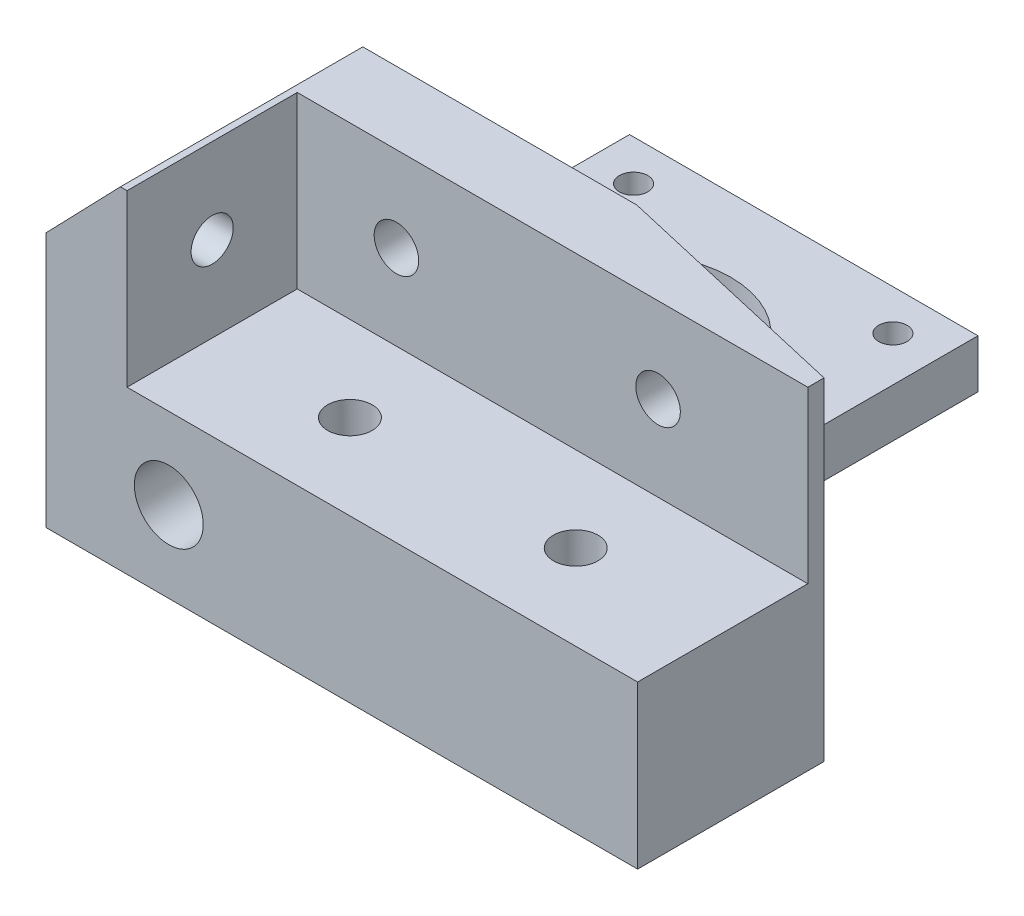
from build123d import *

# Parameters (mm, degrees)
SKETCH_1_R          = 12
SKETCH_1_R_2        = 1.75
EXTRUDE_1_DEPTH     = 6
EXTRUDE_2_DEPTH     = 35
SKETCH_3_W          = 63
SKETCH_3_H          = 21
CUT_EXTRUDE_1_DEPTH = 21
SKETCH_4_R          = 2.6
CUT_EXTRUDE_2_DEPTH = 87.609201921
CHAMFER_1_SIZE      = 9.5
CHAMFER_1_SIZE_2    = 9.174043361
CUT_EXTRUDE_START   = -10
SKETCH_5_R          = 4.25
CUT_EXTRUDE_3_DEPTH = 5
SKETCH_6_R          = 2.75
CUT_EXTRUDE_4_DEPTH = 78.360370477
CUT_EXTRUDE_START_2 = -4
SKETCH_7_R          = 4.25
CUT_EXTRUDE_5_DEPTH = 5
SKETCH_8_R          = 2.75
CUT_EXTRUDE_6_DEPTH = 64.20427816
SKETCH_10_R         = 4.25
CUT_EXTRUDE_7_DEPTH = 15.5
SKETCH_11_R         = 4.25
CUT_EXTRUDE_8_DEPTH = 20


with BuildPart() as part:
    # Эскиз1 → Бобышка-Вытянуть1 (new body)
    with BuildSketch(Plane(origin=(0, 0, 0), x_dir=(1, 0, 0), z_dir=(0, 1, 0))):
        Polygon((-31.737099952, -43.025037564), (41.262900048, -43.025037564), (41.262900048, -20.025037564), (11.262900048, -13.109402144), (11.262900048, 28.974962436), (-31.737099952, 28.974962436), align=None)
        with Locations(Location((-10.237099952, 7.974962436, 0), (0, 0, 270))):
            Circle(SKETCH_1_R, mode=Mode.SUBTRACT)
        with Locations(Location((-26.237099952, 23.974962436, 0), (0, 0, 270))):
            Circle(SKETCH_1_R_2, mode=Mode.SUBTRACT)
        with Locations(Location((5.762900048, 23.974962436, 0), (0, 0, 270))):
            Circle(SKETCH_1_R_2, mode=Mode.SUBTRACT)
        with Locations(Location((5.762900048, -8.025037564, 0), (0, 0, 270))):
            Circle(SKETCH_1_R_2, mode=Mode.SUBTRACT)
        with Locations(Location((-26.237099952, -8.025037564, 0), (0, 0, 270))):
            Circle(SKETCH_1_R_2, mode=Mode.SUBTRACT)
    extrude(amount=EXTRUDE_1_DEPTH)

    # Эскиз2 → Бобышка-Вытянуть2 (add)
    with BuildSketch(Plane(origin=(0, 6, 0), x_dir=(1, 0, 0), z_dir=(0, 1, 0))):
        Polygon((41.262900048, -20.025037564), (11.262900048, -13.109402144), (-31.737099952, -13.109402144), (-31.737099952, -43.025037564), (41.262900048, -43.025037564), align=None)
    extrude(amount=EXTRUDE_2_DEPTH)

    # Эскиз3 → Вырез-Вытянуть1 (cut)
    with BuildSketch(Plane(origin=(0, 41, 0), x_dir=(1, 0, 0), z_dir=(0, 1, 0))):
        with Locations((9.762900048, -32.525037564)):
            Rectangle(SKETCH_3_W, SKETCH_3_H)
    extrude(amount=-CUT_EXTRUDE_1_DEPTH, mode=Mode.SUBTRACT)

    # Эскиз4 → Вырез-Вытянуть2 (cut, through all)
    with BuildSketch(Plane(origin=(-21.737099952, 0, 0), x_dir=(0, 0, -1), z_dir=(1, 0, 0))):
        with Locations((-32.525037564, 30.5)):
            Circle(SKETCH_4_R)
    extrude(amount=-CUT_EXTRUDE_2_DEPTH, mode=Mode.SUBTRACT)

    # Фаска1
    # the kernel refuses this chamfer: 9.5, 9.174043361 mm, written as the material it takes off along each edge
    with BuildSketch(Plane(origin=(-31.737099952, 41, -11.332881065), x_dir=(-0.026999337430198715, -0.9996354514413394, 0), z_dir=(0, 0, 1))) as chamfer_1_piece_1:
        Polygon((CHAMFER_1_SIZE * 0.999635451441, CHAMFER_1_SIZE * 0.0269993374302), (-CHAMFER_1_SIZE_2 * 0.0269993374292, CHAMFER_1_SIZE_2 * 0.999635451405), (0, 0), align=None)
    extrude(amount=78.800201839, mode=Mode.SUBTRACT)

    # Эскиз5 → Вырез-Вытянуть3 (cut)
    with BuildSketch(Plane(origin=(-21.737099952, 0, 0), x_dir=(0, 0, -1), z_dir=(1, 0, 0)).offset(CUT_EXTRUDE_START)):
        with Locations(Location((-32.525037564, 30.5, 0), (0, 0, 166.391039369))):
            Circle(SKETCH_5_R)
    extrude(amount=CUT_EXTRUDE_3_DEPTH, mode=Mode.SUBTRACT)

    # Эскиз6 → Вырез-Вытянуть4 (cut, through all)
    with BuildSketch(Plane.XY.offset(22.025037564)):
        with Locations((-9.495708976, 30.5)):
            Circle(SKETCH_6_R)
        with Locations((22.785725254, 30.5)):
            Circle(SKETCH_6_R)
    extrude(amount=-CUT_EXTRUDE_4_DEPTH, mode=Mode.SUBTRACT)

    # Эскиз7 → Вырез-Вытянуть5 (cut)
    with BuildSketch(Plane.XY.offset(22.025037564).offset(CUT_EXTRUDE_START_2)):
        with Locations((-9.495708976, 30.5)):
            Circle(SKETCH_7_R)
        with Locations((22.785725254, 30.5)):
            Circle(SKETCH_7_R)
    extrude(amount=-CUT_EXTRUDE_5_DEPTH, mode=Mode.SUBTRACT)

    # Эскиз8 → Вырез-Вытянуть6 (cut, through all)
    with BuildSketch(Plane(origin=(0, 20, 0), x_dir=(1, 0, 0), z_dir=(0, 1, 0))):
        with Locations(Location((-4.737013791, -32.525037564, 0), (0, 0, 270))):
            Circle(SKETCH_8_R)
        with Locations(Location((23.126402015, -32.525037564, 0), (0, 0, 270))):
            Circle(SKETCH_8_R)
    extrude(amount=-CUT_EXTRUDE_6_DEPTH, mode=Mode.SUBTRACT)

    # Эскиз10 → Вырез-Вытянуть7 (cut)
    with BuildSketch(Plane.XZ):
        with Locations(Location((23.126402015, 32.525037564, 0), (0, 0, 270))):
            Circle(SKETCH_10_R)
        with Locations(Location((-4.737013791, 32.525037564, 0), (0, 0, 270))):
            Circle(SKETCH_10_R)
    extrude(amount=-CUT_EXTRUDE_7_DEPTH, mode=Mode.SUBTRACT)

    # Эскиз11 → Вырез-Вытянуть8 (cut)
    with BuildSketch(Plane.XY.offset(43.025037564)):
        with Locations((-16.587099952, 10)):
            Circle(SKETCH_11_R)
    extrude(amount=-CUT_EXTRUDE_8_DEPTH, mode=Mode.SUBTRACT)


solid = part.part
